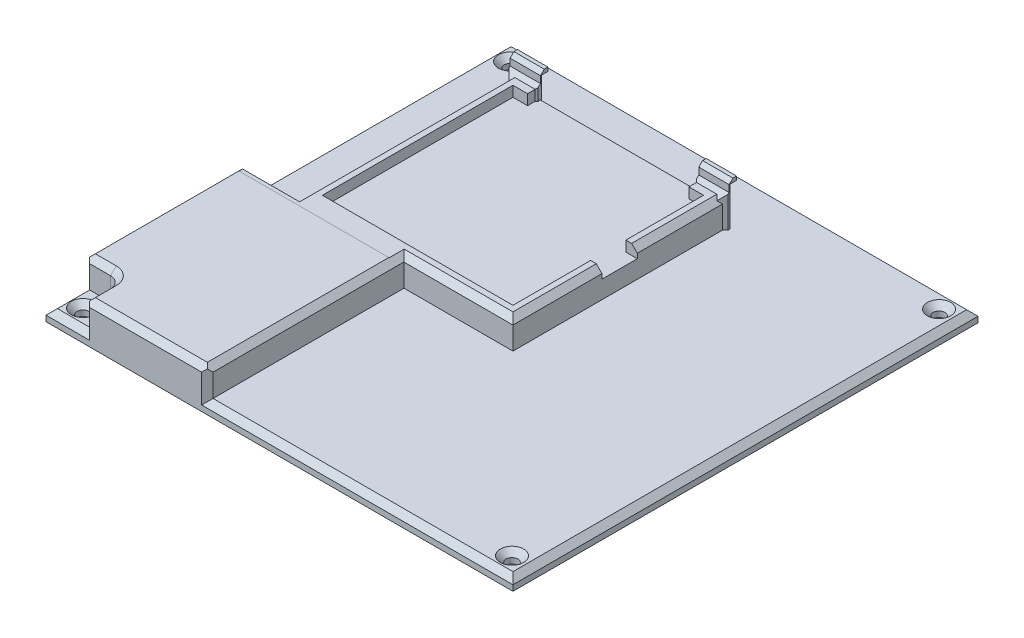
from build123d import *

# Parameters (mm, degrees)
BOSS_EXTRUDE1_DEPTH   = 5.5
BOSS_EXTRUDE1_2_DEPTH = 5.5
SKETCH2_W             = 112.4
SKETCH2_H             = 112.4
BOSS_EXTRUDE2_DEPTH   = 9.4
BOSS_EXTRUDE3_START   = 9.4
SKETCH2_3_W           = 246
SKETCH2_3_H           = 245
BOSS_EXTRUDE3_DEPTH   = 6
SKETCH3_R             = 3.1
CUT_EXTRUDE1_DEPTH    = 251.310147617
BOSS_EXTRUDE4_DEPTH   = 15
SKETCH5_W             = 16
SKETCH5_H             = 22.5
BOSS_EXTRUDE5_DEPTH   = 3.9
SKETCH6_W             = 16
SKETCH6_H             = 20.5
CUT_EXTRUDE2_DEPTH    = 3.4
CHAMFER1_SIZE         = 2
CHAMFER2_SIZE         = 3.05
CHAMFER3_SIZE         = 3
CHAMFER4_SIZE         = 3
SKETCH8_W             = 79.1
SKETCH8_H             = 5
CUT_EXTRUDE3_DEPTH    = 0.1


with BuildPart() as part:
    # Sketch1 → Boss-Extrude1 (new body)
    with BuildSketch(Plane(origin=(0, 0, 0), x_dir=(1, 0, 0), z_dir=(0, 1, 0))):
        Polygon((-6, -6), (-6, 106.4), (7.7, 106.4), (7.7, 100.4), (0, 100.4), (0, 0), (100.4, 0), (100.4, 40.9), (106.4, 40.9), (106.4, -6), align=None)
    extrude(amount=BOSS_EXTRUDE1_DEPTH)



with BuildPart() as body_2:
    # Sketch1 → Boss-Extrude1 2 (new body)
    with BuildSketch(Plane(origin=(0, 0, 0), x_dir=(1, 0, 0), z_dir=(0, 1, 0))):
        Polygon((92.7, 100.4), (92.7, 106.4), (106.4, 106.4), (106.4, 59.5), (100.4, 59.5), (100.4, 100.4), align=None)
    extrude(amount=BOSS_EXTRUDE1_2_DEPTH)


with BuildPart() as part_1:
    add(part.part)

    add(body_2.part)  # Boss-Extrude2 merges body 2
    # Sketch2 → Boss-Extrude2 (add)
    with BuildSketch(Plane.XZ):
        with Locations((50.2, -50.2)):
            Rectangle(SKETCH2_W, SKETCH2_H)
    extrude(amount=BOSS_EXTRUDE2_DEPTH)

    # Sketch2<3> → Boss-Extrude3 (add)
    with BuildSketch(Plane.XZ.offset(BOSS_EXTRUDE3_START)):
        with Locations((87, -12.9)):
            Rectangle(SKETCH2_3_W, SKETCH2_3_H)
    extrude(amount=BOSS_EXTRUDE3_DEPTH)

    # Sketch3 → Cut-Extrude1 (cut, through all)
    with BuildSketch(Plane(origin=(0, -9.4, 0), x_dir=(1, 0, 0), z_dir=(0, 1, 0))):
        with Locations(Location((-26.5, 125.4, 0), (0, 0, 270))):
            Circle(SKETCH3_R)
        with Locations(Location((-26.5, -99.6, 0), (0, 0, 90))):
            Circle(SKETCH3_R)
        with Locations(Location((199.5, 125.4, 0), (0, 0, 270))):
            Circle(SKETCH3_R)
        with Locations(Location((199.5, -99.6, 0), (0, 0, 270))):
            Circle(SKETCH3_R)
    extrude(amount=-CUT_EXTRUDE1_DEPTH, mode=Mode.SUBTRACT)

    # Sketch4 → Boss-Extrude4 (add)
    with BuildSketch(Plane(origin=(0, -9.4, 0), x_dir=(1, 0, 0), z_dir=(0, 1, 0))):
        with BuildLine():
            Line((-16, -109.6), (49, -109.6))
            Line((49, -109.6), (49, -6))
            Line((49, -6), (-36, -6))
            Line((-36, -6), (-36, -89.6))
            Line((-36, -89.6), (-22, -89.6))
            ThreePointArc((-22, -89.6), (-17.757359313, -91.357359313), (-16, -95.6))
            Line((-16, -95.6), (-16, -109.6))
        make_face()
    extrude(amount=BOSS_EXTRUDE4_DEPTH)

    # Sketch5 → Boss-Extrude5 (add)
    with BuildSketch(Plane(origin=(0, 0, -106.4), x_dir=(-1, 0, 0), z_dir=(0, 0, -1))):
        with Locations((-99.9, 1.85)):
            Rectangle(SKETCH5_W, SKETCH5_H)
        with Locations((-0.5, 1.85)):
            Rectangle(SKETCH5_W, SKETCH5_H)
    extrude(amount=BOSS_EXTRUDE5_DEPTH)

    # Sketch6 → Cut-Extrude2 (cut)
    with BuildSketch(Plane(origin=(0, 0, -110.3), x_dir=(-1, 0, 0), z_dir=(0, 0, -1))):
        with Locations((-0.5, 0.85)):
            Rectangle(SKETCH6_W, SKETCH6_H)
        with Locations((-99.9, 0.85)):
            Rectangle(SKETCH6_W, SKETCH6_H)
    extrude(amount=-CUT_EXTRUDE2_DEPTH, mode=Mode.SUBTRACT)

    # Chamfer1
    # the kernel refuses this chamfer: 2 mm, written as the material it adds along each edge
    with BuildSketch(Plane(origin=(92.7, -5.143365976, -106.4), x_dir=(-0.9996219169112968, 0, -0.027495876610589005), z_dir=(0, 1, 0))) as chamfer1_piece_1_section:
        Polygon((CHAMFER1_SIZE * 0.999621916911, CHAMFER1_SIZE * 0.0274958766106), (-CHAMFER1_SIZE * 0.0274958766106, CHAMFER1_SIZE * 0.999621916911), (0, 0), align=None)
    chamfer1_piece_1 = extrude(amount=10.643365976, mode=Mode.PRIVATE)
    chamfer1_piece_1 = split(chamfer1_piece_1, bisect_by=Plane(origin=(91.9, -2.571682988, -105.57221902), z_dir=(1, 0, 0)), keep=Keep.TOP, mode=Mode.PRIVATE)
    add(chamfer1_piece_1)
    with BuildSketch(Plane(origin=(92.7, 5.5, -106.4), x_dir=(0, 0.9996219169112968, -0.027495876610589075), z_dir=(1, 0, 0)), Plane(origin=(-6, 5.5, -106.4), x_dir=(0, 0.9996219169112968, -0.027495876610589075), z_dir=(1, 0, 0))) as chamfer1_piece_2:
        Polygon((CHAMFER1_SIZE * 0.999621916911, CHAMFER1_SIZE * 0.0274958766106), (-CHAMFER1_SIZE * 0.0274958766106, CHAMFER1_SIZE * 0.999621916911), (0, 0), align=None)
    extrude(amount=13.7)
    with BuildSketch(Plane(origin=(106.4, 5.5, -106.4), x_dir=(-0.027495876610589005, 0, 0.9996219169112968), z_dir=(0, -1, 0))) as chamfer1_piece_3_section:
        Polygon((CHAMFER1_SIZE * 0.999621916911, -CHAMFER1_SIZE * 0.0274958766106), (-CHAMFER1_SIZE * 0.0274958766106, -CHAMFER1_SIZE * 0.999621916911), (0, 0), align=None)
    chamfer1_piece_3 = extrude(amount=14.9, mode=Mode.PRIVATE)
    chamfer1_piece_3 = split(chamfer1_piece_3, bisect_by=Plane(origin=(107.9, -1.95, -105.69608178), z_dir=(-1, 0, 0)), keep=Keep.TOP, mode=Mode.PRIVATE)
    add(chamfer1_piece_3)
    with BuildSketch(Plane(origin=(106.4, 5.5, -106.4), x_dir=(-0.027495876610589005, 0, 0.9996219169112968), z_dir=(0, -1, 0))) as chamfer1_piece_4_section:
        Polygon((CHAMFER1_SIZE * 0.999621916911, -CHAMFER1_SIZE * 0.0274958766106), (-CHAMFER1_SIZE * 0.0274958766106, -CHAMFER1_SIZE * 0.999621916911), (0, 0), align=None)
    chamfer1_piece_4 = extrude(amount=20.043365976, mode=Mode.PRIVATE)
    chamfer1_piece_4 = split(chamfer1_piece_4, bisect_by=Plane(origin=(106.974972825, -9.4, -105.69608178), z_dir=(0, -1, 0)), keep=Keep.TOP, mode=Mode.PRIVATE)
    chamfer1_piece_4 = split(chamfer1_piece_4, bisect_by=Plane(origin=(107.9, -11.971682988, -105.69608178), z_dir=(-1, 0, 0)), keep=Keep.TOP, mode=Mode.PRIVATE)
    add(chamfer1_piece_4)
    with BuildSketch(Plane(origin=(106.4, 5.5, -106.4), x_dir=(-0.027495876610589005, 0, 0.9996219169112968), z_dir=(0, -1, 0))) as chamfer1_piece_5_section:
        Polygon((CHAMFER1_SIZE * 0.999621916911, -CHAMFER1_SIZE * 0.0274958766106), (-CHAMFER1_SIZE * 0.0274958766106, -CHAMFER1_SIZE * 0.999621916911), (0, 0), align=None)
    chamfer1_piece_5 = extrude(amount=20.043365976, mode=Mode.PRIVATE)
    chamfer1_piece_5 = split(chamfer1_piece_5, bisect_by=Plane(origin=(108.09753906, -9.4, -106.284213701), z_dir=(0, -1, 0)), keep=Keep.TOP, mode=Mode.PRIVATE)
    chamfer1_piece_5 = split(chamfer1_piece_5, bisect_by=Plane(origin=(107.9, -11.971682988, -106.284213701), z_dir=(1, 0, 0)), keep=Keep.TOP, mode=Mode.PRIVATE)
    add(chamfer1_piece_5)
    with BuildSketch(Plane(origin=(7.7, -5.143365976, -106.4), x_dir=(0.9996219169112965, 0, -0.027495876610589057), z_dir=(0, 1, 0))) as chamfer1_piece_6_section:
        Polygon((CHAMFER1_SIZE * 0.999621916911, -CHAMFER1_SIZE * 0.0274958766106), (-CHAMFER1_SIZE * 0.0274958766106, -CHAMFER1_SIZE * 0.999621916911), (0, 0), align=None)
    chamfer1_piece_6 = extrude(amount=10.643365976, mode=Mode.PRIVATE)
    chamfer1_piece_6 = split(chamfer1_piece_6, bisect_by=Plane(origin=(8.5, -2.571682988, -105.57221902), z_dir=(-1, 0, 0)), keep=Keep.TOP, mode=Mode.PRIVATE)
    add(chamfer1_piece_6)
    with BuildSketch(Plane(origin=(-6, 5.5, -106.4), x_dir=(-0.9996219169112968, 0, -0.027495876610589075), z_dir=(0, -1, 0))) as chamfer1_piece_7_section:
        Polygon((CHAMFER1_SIZE * 0.999621916911, -CHAMFER1_SIZE * 0.0274958766106), (-CHAMFER1_SIZE * 0.0274958766106, -CHAMFER1_SIZE * 0.999621916911), (0, 0), align=None)
    chamfer1_piece_7 = extrude(amount=14.9, mode=Mode.PRIVATE)
    chamfer1_piece_7 = split(chamfer1_piece_7, bisect_by=Plane(origin=(-7.5, -1.95, -105.69608178), z_dir=(1, 0, 0)), keep=Keep.TOP, mode=Mode.PRIVATE)
    add(chamfer1_piece_7)
    with BuildSketch(Plane(origin=(-6, 5.5, -106.4), x_dir=(-0.9996219169112968, 0, -0.027495876610589075), z_dir=(0, -1, 0))) as chamfer1_piece_8_section:
        Polygon((CHAMFER1_SIZE * 0.999621916911, -CHAMFER1_SIZE * 0.0274958766106), (-CHAMFER1_SIZE * 0.0274958766106, -CHAMFER1_SIZE * 0.999621916911), (0, 0), align=None)
    chamfer1_piece_8 = extrude(amount=20.043365976, mode=Mode.PRIVATE)
    chamfer1_piece_8 = split(chamfer1_piece_8, bisect_by=Plane(origin=(-7.69753906, -9.4, -106.284213701), z_dir=(0, -1, 0)), keep=Keep.TOP, mode=Mode.PRIVATE)
    chamfer1_piece_8 = split(chamfer1_piece_8, bisect_by=Plane(origin=(-7.5, -11.971682988, -106.284213701), z_dir=(-1, 0, 0)), keep=Keep.TOP, mode=Mode.PRIVATE)
    add(chamfer1_piece_8)
    with BuildSketch(Plane(origin=(-6, 5.5, -106.4), x_dir=(-0.9996219169112968, 0, -0.027495876610589075), z_dir=(0, -1, 0))) as chamfer1_piece_9_section:
        Polygon((CHAMFER1_SIZE * 0.999621916911, -CHAMFER1_SIZE * 0.0274958766106), (-CHAMFER1_SIZE * 0.0274958766106, -CHAMFER1_SIZE * 0.999621916911), (0, 0), align=None)
    chamfer1_piece_9 = extrude(amount=20.043365976, mode=Mode.PRIVATE)
    chamfer1_piece_9 = split(chamfer1_piece_9, bisect_by=Plane(origin=(-6.574972825, -9.4, -105.69608178), z_dir=(0, -1, 0)), keep=Keep.TOP, mode=Mode.PRIVATE)
    chamfer1_piece_9 = split(chamfer1_piece_9, bisect_by=Plane(origin=(-7.5, -11.971682988, -105.69608178), z_dir=(1, 0, 0)), keep=Keep.TOP, mode=Mode.PRIVATE)
    add(chamfer1_piece_9)
    with BuildSketch(Plane(origin=(87.556634024, 5.5, -106.4), x_dir=(0, 0.9996219169112968, -0.027495876610589075), z_dir=(1, 0, 0))) as chamfer1_piece_10a_section:
        Polygon((CHAMFER1_SIZE * 0.999621916911, CHAMFER1_SIZE * 0.0274958766106), (-CHAMFER1_SIZE * 0.0274958766106, CHAMFER1_SIZE * 0.999621916911), (0, 0), align=None)
    chamfer1_piece_10a = extrude(amount=18.843365976, mode=Mode.PRIVATE)
    chamfer1_piece_10a = split(chamfer1_piece_10a, bisect_by=Plane(origin=(91.9, 6.159587254, -105.740412746), z_dir=(1, 0, 0)), keep=Keep.TOP, mode=Mode.PRIVATE)
    chamfer1_piece_10a = split(chamfer1_piece_10a, bisect_by=Plane(origin=(92.7, 6.159587254, -105.740412746), z_dir=(-1, 0, 0)), keep=Keep.TOP, mode=Mode.PRIVATE)
    with BuildSketch(Plane(origin=(92.7, 0, -106.4), x_dir=(-0.9996219169112968, 0, -0.027495876610589005), z_dir=(0, 1, 0))) as chamfer1_piece_10b_section:
        Polygon((CHAMFER1_SIZE * 0.999621916911, CHAMFER1_SIZE * 0.0274958766106), (-CHAMFER1_SIZE * 0.0274958766106, CHAMFER1_SIZE * 0.999621916911), (0, 0), align=None)
    chamfer1_piece_10b = extrude(amount=10.643365976, mode=Mode.PRIVATE)
    chamfer1_piece_10b = split(chamfer1_piece_10b, bisect_by=Plane(origin=(91.9, 8.071682988, -105.57221902), z_dir=(1, 0, 0)), keep=Keep.TOP, mode=Mode.PRIVATE)
    chamfer1_piece_10b = split(chamfer1_piece_10b, bisect_by=Plane(origin=(92.36112716, 5.5, -105.57221902), z_dir=(0, 1, 0)), keep=Keep.TOP, mode=Mode.PRIVATE)
    chamfer1_piece_10 = chamfer1_piece_10a & chamfer1_piece_10b
    add(chamfer1_piece_10)
    with BuildSketch(Plane(origin=(106.4, 10.643365976, -106.4), x_dir=(-0.027495876610589005, 0, 0.9996219169112968), z_dir=(0, -1, 0))) as chamfer1_piece_11a_section:
        Polygon((CHAMFER1_SIZE * 0.999621916911, -CHAMFER1_SIZE * 0.0274958766106), (-CHAMFER1_SIZE * 0.0274958766106, -CHAMFER1_SIZE * 0.999621916911), (0, 0), align=None)
    chamfer1_piece_11a = extrude(amount=20.043365976, mode=Mode.PRIVATE)
    chamfer1_piece_11a = split(chamfer1_piece_11a, bisect_by=Plane(origin=(106.974972825, 5.5, -105.69608178), z_dir=(0, 1, 0)), keep=Keep.TOP, mode=Mode.PRIVATE)
    chamfer1_piece_11a = split(chamfer1_piece_11a, bisect_by=Plane(origin=(107.9, 8.071682988, -105.69608178), z_dir=(-1, 0, 0)), keep=Keep.TOP, mode=Mode.PRIVATE)
    with BuildSketch(Plane(origin=(92.7, 5.5, -106.4), x_dir=(0, 0.9996219169112968, -0.027495876610589075), z_dir=(1, 0, 0))) as chamfer1_piece_11b_section:
        Polygon((CHAMFER1_SIZE * 0.999621916911, CHAMFER1_SIZE * 0.0274958766106), (-CHAMFER1_SIZE * 0.0274958766106, CHAMFER1_SIZE * 0.999621916911), (0, 0), align=None)
    chamfer1_piece_11b = extrude(amount=18.843365976, mode=Mode.PRIVATE)
    chamfer1_piece_11b = split(chamfer1_piece_11b, bisect_by=Plane(origin=(106.4, 6.159587254, -105.740412746), z_dir=(1, 0, 0)), keep=Keep.TOP, mode=Mode.PRIVATE)
    chamfer1_piece_11b = split(chamfer1_piece_11b, bisect_by=Plane(origin=(107.9, 6.159587254, -105.740412746), z_dir=(-1, 0, 0)), keep=Keep.TOP, mode=Mode.PRIVATE)
    chamfer1_piece_11 = chamfer1_piece_11a & chamfer1_piece_11b
    add(chamfer1_piece_11)
    with BuildSketch(Plane(origin=(-6, 5.5, -106.4), x_dir=(0, 0.9996219169112968, -0.027495876610589075), z_dir=(1, 0, 0))) as chamfer1_piece_12a_section:
        Polygon((CHAMFER1_SIZE * 0.999621916911, CHAMFER1_SIZE * 0.0274958766106), (-CHAMFER1_SIZE * 0.0274958766106, CHAMFER1_SIZE * 0.999621916911), (0, 0), align=None)
    chamfer1_piece_12a = extrude(amount=18.843365976, mode=Mode.PRIVATE)
    chamfer1_piece_12a = split(chamfer1_piece_12a, bisect_by=Plane(origin=(8.5, 6.159587254, -105.740412746), z_dir=(-1, 0, 0)), keep=Keep.TOP, mode=Mode.PRIVATE)
    chamfer1_piece_12a = split(chamfer1_piece_12a, bisect_by=Plane(origin=(7.7, 6.159587254, -105.740412746), z_dir=(1, 0, 0)), keep=Keep.TOP, mode=Mode.PRIVATE)
    with BuildSketch(Plane(origin=(7.7, 0, -106.4), x_dir=(0.9996219169112965, 0, -0.027495876610589057), z_dir=(0, 1, 0))) as chamfer1_piece_12b_section:
        Polygon((CHAMFER1_SIZE * 0.999621916911, -CHAMFER1_SIZE * 0.0274958766106), (-CHAMFER1_SIZE * 0.0274958766106, -CHAMFER1_SIZE * 0.999621916911), (0, 0), align=None)
    chamfer1_piece_12b = extrude(amount=10.643365976, mode=Mode.PRIVATE)
    chamfer1_piece_12b = split(chamfer1_piece_12b, bisect_by=Plane(origin=(8.5, 8.071682988, -105.57221902), z_dir=(-1, 0, 0)), keep=Keep.TOP, mode=Mode.PRIVATE)
    chamfer1_piece_12b = split(chamfer1_piece_12b, bisect_by=Plane(origin=(8.03887284, 5.5, -105.57221902), z_dir=(0, 1, 0)), keep=Keep.TOP, mode=Mode.PRIVATE)
    chamfer1_piece_12 = chamfer1_piece_12a & chamfer1_piece_12b
    add(chamfer1_piece_12)
    with BuildSketch(Plane(origin=(-6, 10.643365976, -106.4), x_dir=(-0.9996219169112968, 0, -0.027495876610589075), z_dir=(0, -1, 0))) as chamfer1_piece_13a_section:
        Polygon((CHAMFER1_SIZE * 0.999621916911, -CHAMFER1_SIZE * 0.0274958766106), (-CHAMFER1_SIZE * 0.0274958766106, -CHAMFER1_SIZE * 0.999621916911), (0, 0), align=None)
    chamfer1_piece_13a = extrude(amount=20.043365976, mode=Mode.PRIVATE)
    chamfer1_piece_13a = split(chamfer1_piece_13a, bisect_by=Plane(origin=(-7.5, 8.071682988, -105.69608178), z_dir=(1, 0, 0)), keep=Keep.TOP, mode=Mode.PRIVATE)
    chamfer1_piece_13a = split(chamfer1_piece_13a, bisect_by=Plane(origin=(-6.574972825, 5.5, -105.69608178), z_dir=(0, 1, 0)), keep=Keep.TOP, mode=Mode.PRIVATE)
    with BuildSketch(Plane(origin=(-11.143365976, 5.5, -106.4), x_dir=(0, 0.9996219169112968, -0.027495876610589075), z_dir=(1, 0, 0))) as chamfer1_piece_13b_section:
        Polygon((CHAMFER1_SIZE * 0.999621916911, CHAMFER1_SIZE * 0.0274958766106), (-CHAMFER1_SIZE * 0.0274958766106, CHAMFER1_SIZE * 0.999621916911), (0, 0), align=None)
    chamfer1_piece_13b = extrude(amount=18.843365976, mode=Mode.PRIVATE)
    chamfer1_piece_13b = split(chamfer1_piece_13b, bisect_by=Plane(origin=(-7.5, 6.159587254, -105.740412746), z_dir=(1, 0, 0)), keep=Keep.TOP, mode=Mode.PRIVATE)
    chamfer1_piece_13b = split(chamfer1_piece_13b, bisect_by=Plane(origin=(-6, 6.159587254, -105.740412746), z_dir=(-1, 0, 0)), keep=Keep.TOP, mode=Mode.PRIVATE)
    chamfer1_piece_13 = chamfer1_piece_13a & chamfer1_piece_13b
    add(chamfer1_piece_13)
    # the kernel refuses this chamfer: 2 mm, written as the material it takes off along each edge
    with BuildSketch(Plane(origin=(113.043365976, 13.1, -106.4), x_dir=(1.4427442484973125e-15, -0.9996219169112968, 0.027495876610589075), z_dir=(-1, 0, 0)), Plane(origin=(-12.643365976, 13.1, -106.4), x_dir=(0, 0.027495876610586414, -0.9996219169112968), z_dir=(1, 0, 0))) as chamfer1_2_piece_1:
        Polygon((CHAMFER1_SIZE * 0.999621916911, -CHAMFER1_SIZE * 0.0274958766106), (-CHAMFER1_SIZE * 0.0274958766106, -CHAMFER1_SIZE * 0.999621916911), (0, 0), align=None)
    extrude(amount=26.286731952, mode=Mode.SUBTRACT)

    # Chamfer2
    chamfer2_edges = [part_1.edges().sort_by_distance(p)[0] for p in [
        (199.5, -9.4, -128.5),
        (-26.5, -9.4, -128.5),
        (-26.5, -9.4, 102.7),
        (199.5, -9.4, 96.5),
    ]]
    chamfer(chamfer2_edges, length=CHAMFER2_SIZE)

    # Chamfer3
    chamfer3_edges = [part_1.edges().sort_by_distance(p)[0] for p in [
        (106.4, 5.5, -17.45),
    ]]
    chamfer(chamfer3_edges, length=CHAMFER3_SIZE)
    chamfer3_2_edges = [part_1.edges().sort_by_distance(p)[0] for p in [
        (106.4, 5.5, -81.95),
    ]]
    chamfer(chamfer3_2_edges, length=CHAMFER3_SIZE)
    chamfer3_3_edges = [part_1.edges().sort_by_distance(p)[0] for p in [
        (76.2, 5.5, 6),
    ]]
    chamfer(chamfer3_3_edges, length=CHAMFER3_SIZE)
    chamfer3_4_edges = [part_1.edges().sort_by_distance(p)[0] for p in [
        (49, 5.6, 57.8),
    ]]
    chamfer(chamfer3_4_edges, length=CHAMFER3_SIZE)
    chamfer3_5_edges = [part_1.edges().sort_by_distance(p)[0] for p in [
        (15, 5.6, 109.6),
    ]]
    chamfer(chamfer3_5_edges, length=CHAMFER3_SIZE)
    chamfer3_6_edges = [part_1.edges().sort_by_distance(p)[0] for p in [
        (-36, 5.6, 47.8),
    ]]
    chamfer(chamfer3_6_edges, length=CHAMFER3_SIZE)
    chamfer3_7_edges = [part_1.edges().sort_by_distance(p)[0] for p in [
        (-6, 5.5, -49.2),
    ]]
    chamfer(chamfer3_7_edges, length=CHAMFER3_SIZE)
    chamfer3_8_edges = [part_1.edges().sort_by_distance(p)[0] for p in [
        (-16, 5.6, 101.1),
        (-27.5, 5.6, 89.6),
        (-17.757359313, 5.6, 91.357359313),
    ]]
    chamfer(chamfer3_8_edges, length=CHAMFER3_SIZE)

    # Chamfer4
    chamfer4_edges = [part_1.edges().sort_by_distance(p)[0] for p in [
        (-36, -9.4, -64.7),
        (129.5, -9.4, 109.6),
        (-36, -3.4, 89.6),
        (-36, -3.4, 6),
        (-16, -3.4, 109.6),
        (49, -3.4, 109.6),
        (-36, -9.4, 99.6),
        (87, -9.4, -135.4),
        (-26, -9.4, 109.6),
        (210, -9.4, -12.9),
    ]]
    chamfer(chamfer4_edges, length=CHAMFER4_SIZE)

    # Sketch8 → Cut-Extrude3 (cut)
    with BuildSketch(Plane(origin=(0, 5.6, 0), x_dir=(1, 0, 0), z_dir=(0, 1, 0))):
        with Locations((6.55, -8.5)):
            Rectangle(SKETCH8_W, SKETCH8_H)
    extrude(amount=-CUT_EXTRUDE3_DEPTH, mode=Mode.SUBTRACT)

    # Chamfer5
    # the kernel refuses this chamfer: 3 mm, written as the material it takes off along each edge
    with BuildSketch(Plane(origin=(6.229157809, 5.5, 6), x_dir=(0, -0.9850292351397439, -0.17238737169529297), z_dir=(-1, 0, 0))) as chamfer5_piece_1_section:
        with BuildLine():
            Line((3.691663124, 0), (-1.253737533, 3.472249821))
            Line((-1.253737533, 3.472249821), (-1.697000689, 3.394675503))
            ThreePointArc((-1.697000689, 3.394675503), (-0.756697539, 1.713403919), (-0.443263156, -0.077574317))
            Line((-0.443263156, -0.077574317), (0.077574317, -0.443263156))
            ThreePointArc((0.077574317, -0.443263156), (1.868552553, -0.129828772), (3.769237441, -0.443263156))
            Line((3.769237441, -0.443263156), (3.691663124, 0))
        make_face()
    chamfer5_piece_1 = extrude(amount=39.229157809, mode=Mode.PRIVATE)
    chamfer5_piece_1 = split(chamfer5_piece_1, bisect_by=Plane(origin=(-4.039459416, 4.460540584, 7.280331392), z_dir=(-0.7071067811865476, 0.7071067811865476, 0)), keep=Keep.TOP, mode=Mode.PRIVATE)
    chamfer5_piece_1 = split(chamfer5_piece_1, bisect_by=Plane(origin=(-6, 5.114054112, 7.280331392), z_dir=(1, 0, 0)), keep=Keep.TOP, mode=Mode.PRIVATE)
    add(chamfer5_piece_1, mode=Mode.SUBTRACT)
    with BuildSketch(Plane(origin=(6.229157809, 5.5, 6), x_dir=(0, -0.9850292351397439, -0.17238737169529297), z_dir=(-1, 0, 0))) as chamfer5_piece_2_section:
        with BuildLine():
            Line((3.691663124, 0), (-1.253737533, 3.472249821))
            Line((-1.253737533, 3.472249821), (-1.697000689, 3.394675503))
            ThreePointArc((-1.697000689, 3.394675503), (-0.756697539, 1.713403919), (-0.443263156, -0.077574317))
            Line((-0.443263156, -0.077574317), (0.077574317, -0.443263156))
            ThreePointArc((0.077574317, -0.443263156), (1.868552553, -0.129828772), (3.769237441, -0.443263156))
            Line((3.769237441, -0.443263156), (3.691663124, 0))
        make_face()
    chamfer5_piece_2 = extrude(amount=39.229157809, mode=Mode.PRIVATE)
    chamfer5_piece_2 = split(chamfer5_piece_2, bisect_by=Plane(origin=(-6.302738925, 2.197261075, 5.315019574), z_dir=(0.7071067811865476, -0.7071067811865476, 0)), keep=Keep.TOP, mode=Mode.PRIVATE)
    chamfer5_piece_2 = split(chamfer5_piece_2, bisect_by=Plane(origin=(-6, 2.0963481, 5.315019574), z_dir=(-1, 0, 0)), keep=Keep.TOP, mode=Mode.PRIVATE)
    add(chamfer5_piece_2, mode=Mode.SUBTRACT)
    with BuildSketch(Plane(origin=(6.229157809, 5.5, 6), x_dir=(0, -0.9850292351397439, -0.17238737169529297), z_dir=(-1, 0, 0))) as chamfer5_piece_3_section:
        with BuildLine():
            Line((3.691663124, 0), (-1.253737533, 3.472249821))
            Line((-1.253737533, 3.472249821), (-1.697000689, 3.394675503))
            ThreePointArc((-1.697000689, 3.394675503), (-0.756697539, 1.713403919), (-0.443263156, -0.077574317))
            Line((-0.443263156, -0.077574317), (0.077574317, -0.443263156))
            ThreePointArc((0.077574317, -0.443263156), (1.868552553, -0.129828772), (3.769237441, -0.443263156))
            Line((3.769237441, -0.443263156), (3.691663124, 0))
        make_face()
    chamfer5_piece_3 = extrude(amount=39.229157809, mode=Mode.PRIVATE)
    chamfer5_piece_3 = split(chamfer5_piece_3, bisect_by=Plane(origin=(-11.711520685, -3.211520685, 6.918404597), z_dir=(-0.7071067811865476, 0.7071067811865476, 0)), keep=Keep.TOP, mode=Mode.PRIVATE)
    chamfer5_piece_3 = split(chamfer5_piece_3, bisect_by=Plane(origin=(-6, 4.583653926, 6.918404597), z_dir=(-1, 0, 0)), keep=Keep.TOP, mode=Mode.PRIVATE)
    add(chamfer5_piece_3, mode=Mode.SUBTRACT)
    with BuildSketch(Plane(origin=(6.229157809, 5.5, 6), x_dir=(0, -0.9850292351397439, -0.17238737169529297), z_dir=(-1, 0, 0))) as chamfer5_piece_4_section:
        with BuildLine():
            Line((3.691663124, 0), (-1.253737533, 3.472249821))
            Line((-1.253737533, 3.472249821), (-1.697000689, 3.394675503))
            ThreePointArc((-1.697000689, 3.394675503), (-0.756697539, 1.713403919), (-0.443263156, -0.077574317))
            Line((-0.443263156, -0.077574317), (0.077574317, -0.443263156))
            ThreePointArc((0.077574317, -0.443263156), (1.868552553, -0.129828772), (3.769237441, -0.443263156))
            Line((3.769237441, -0.443263156), (3.691663124, 0))
        make_face()
    chamfer5_piece_4 = extrude(amount=48.458315618, mode=Mode.PRIVATE)
    chamfer5_piece_4 = split(chamfer5_piece_4, bisect_by=Plane(origin=(-33, 4.582402261, 6.917597739), z_dir=(-1, 0, 0)), keep=Keep.TOP, mode=Mode.PRIVATE)
    add(chamfer5_piece_4, mode=Mode.SUBTRACT)


solid = part_1.part
